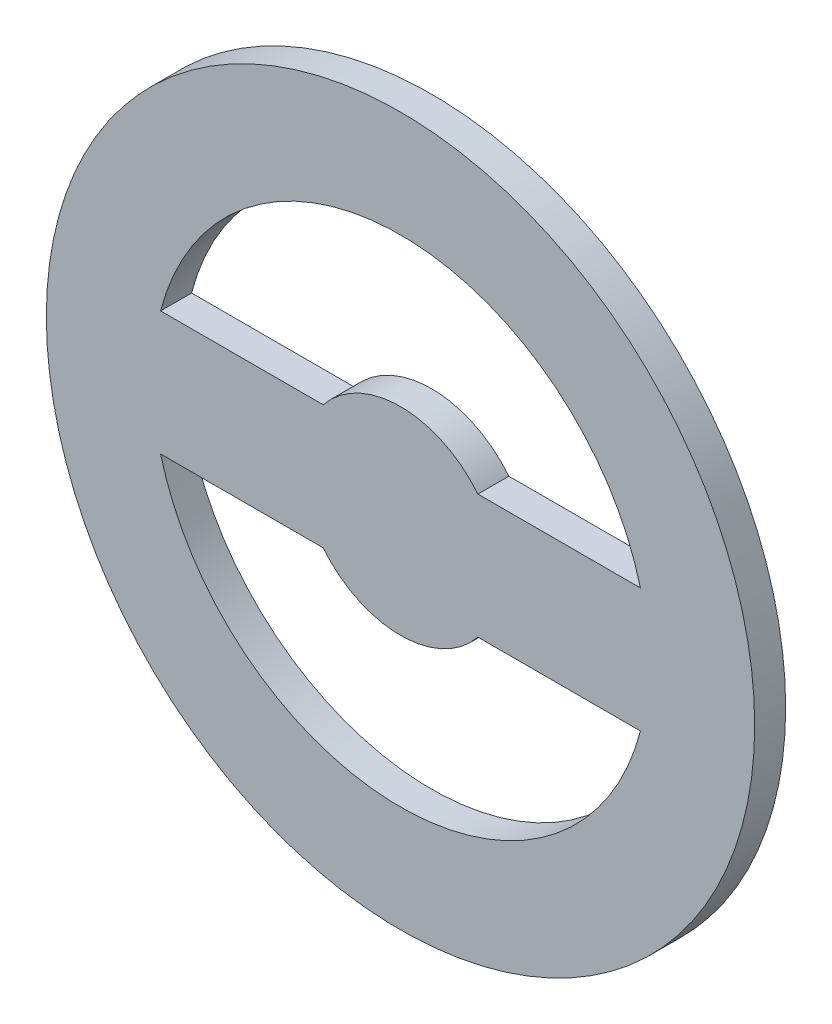
from build123d import *

# Parameters (mm, degrees)
SKETCH1_R           = 36.3093
BOSS_EXTRUDE1_DEPTH = 3.175
CUT_EXTRUDE1_DEPTH  = 52.44716861


with BuildPart() as part:
    # Sketch1 → Boss-Extrude1 (new body)
    with BuildSketch(Plane.XY):
        Circle(SKETCH1_R)
    extrude(amount=BOSS_EXTRUDE1_DEPTH)

    # Sketch2 → Cut-Extrude1 (cut, through all)
    with BuildSketch(Plane.XY.offset(3.175)):
        with BuildLine():
            Line((-24.593444248, -6.35), (-7.931147458, -6.35))
            ThreePointArc((-7.931147458, -6.35), (0, -10.16), (7.931147458, -6.35))
            Line((7.931147458, -6.35), (24.593444248, -6.35))
            ThreePointArc((24.593444248, -6.35), (0, -25.4), (-24.593444248, -6.35))
        make_face()
        with BuildLine():
            Line((7.931147458, 6.35), (24.593444248, 6.35))
            ThreePointArc((24.593444248, 6.35), (0, 25.4), (-24.593444248, 6.35))
            Line((-24.593444248, 6.35), (-7.931147458, 6.35))
            ThreePointArc((-7.931147458, 6.35), (0, 10.16), (7.931147458, 6.35))
        make_face()
    extrude(amount=-CUT_EXTRUDE1_DEPTH, mode=Mode.SUBTRACT)


solid = part.part
